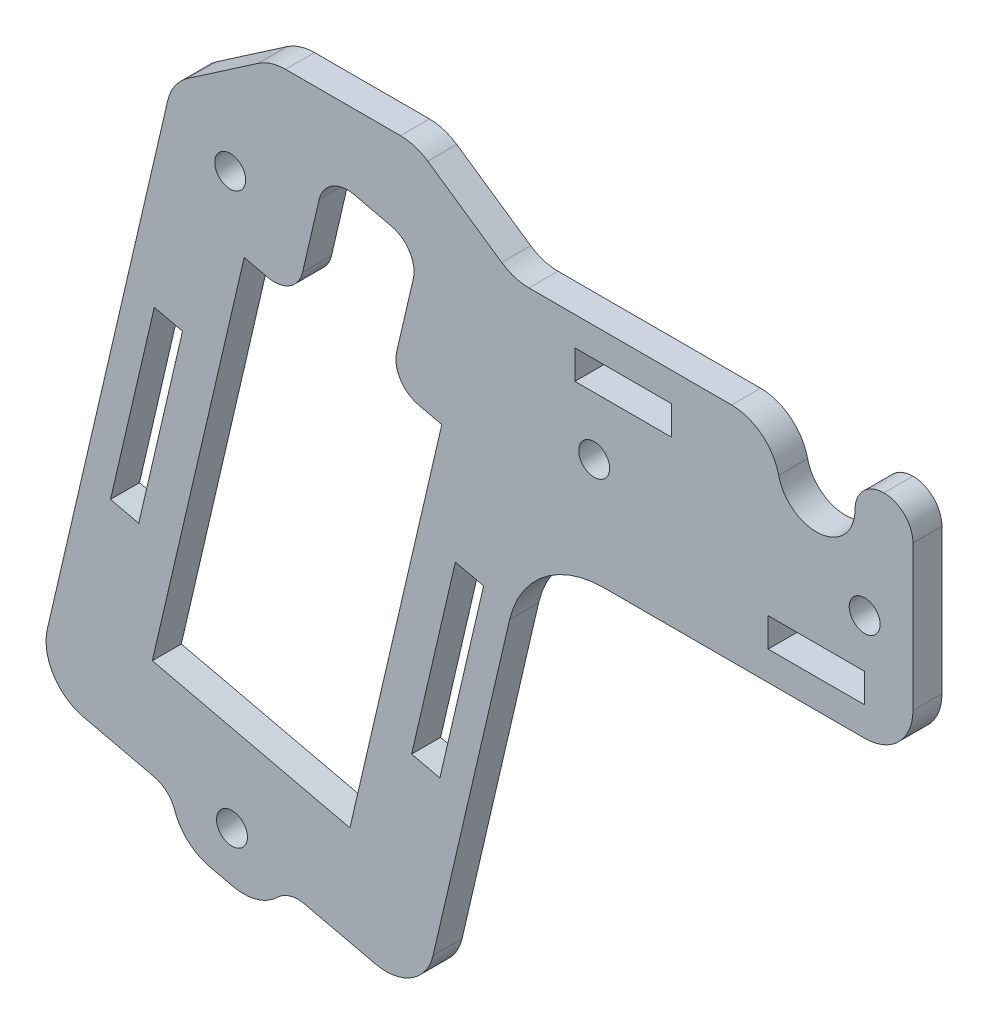
from build123d import *

# Parameters (mm, degrees)
ESBO_O1_R                = 1.6000000000000096
ESBO_O1_R_2              = 1.5999999999999985
ESBO_O1_R_3              = 1.6000000000000019
ESBO_O1_R_4              = 1.6000000000000474
RESSALTO_EXTRUS_O1_DEPTH = 3
FILETE1_R                = 5
FILETE3_R                = 3
FILETE4_R                = 10
FILETE2_R                = 5


with BuildPart() as part:
    # Esboço1 → Ressalto-extrusão1 (new body)
    with BuildSketch(Plane.XY):
        with BuildLine():
            Line((-2.645751311064564, 23.000000000000014), (-31.296028057599443, 23.000000000000004))
            Line((-31.296028057599443, 22.999999999999996), (-41.49853289297047, 29.999999999999996))
            Line((-41.49853289297047, 29.999999999999996), (-56.49853289297047, 29.999999999999996))
            Line((-56.49853289297047, 29.999999999999996), (-66.7010377283415, 23.000000000000014))
            Line((-66.7010377283415, 23.000000000000014), (-80.74287914122172, -37.388961654722316))
            Line((-80.74287914122172, -37.388961654722316), (-65.64563872754113, -40.89942200794237))
            Line((-65.64563872754113, -40.89942200794238), (-66.49494365170727, -44.55198017254248))
            Line((-66.49494365170727, -44.55198017254248), (-56.754788546106894, -46.81679330365219))
            Line((-56.754788546106894, -46.81679330365219), (-55.90548362194077, -43.164235139052074))
            Line((-55.90548362194077, -43.164235139052074), (-40.80824320826024, -46.67469549227213))
            Line((-40.80824320826024, -46.67469549227213), (-29.955288394361567, 0))
            Line((-29.955288394361567, 0), (10, 0))
            Line((10.000000000000002, 0), (10.000000000000002, 23))
            Line((10.000000000000002, 23), (2.6457513110645188, 23.000000000000036))
            ThreePointArc((2.6457513110645325, 23.00000000000005), (2.416e-14, 16), (-2.645751311064569, 23.000000000000018))
        make_face()
        with Locations((-60.49245953335222, -40.81430918529715)):
            Circle(ESBO_O1_R, mode=Mode.SUBTRACT)
        Polygon((-34.44455590239048, -6.060615619977682), (-38.97418216460989, -25.54092583117841), (-41.89622869629002, -24.861481891845507), (-37.36660243407061, -5.381171680644762), align=None, mode=Mode.SUBTRACT)
        Polygon((-70.1426785025311, -18.293523811627356), (-73.06472503421121, -17.61407987229443), (-68.53509877199181, 1.8662303389063053), (-65.61305224031169, 1.1867863995733905), align=None, mode=Mode.SUBTRACT)
        Polygon((-53.86861044577067, 9.749384541179593), (-50.787533444320594, 22.999999999999996), (-41.04737833872022, 20.73518686889029), (-44.12845534017028, 7.484571410069881), (-38.771370032090054, 6.238924187959525), (-48.28358518275084, -34.669727255562044), (-68.73791090451164, -29.91361968023165), (-59.22569575385083, 10.995031763289926), align=None, mode=Mode.SUBTRACT)
        with Locations((-60.676910421506925, 17.999999999999996)):
            Circle(ESBO_O1_R_2, mode=Mode.SUBTRACT)
        Polygon((5.000000000000001, 6), (5, 3.0000000000000018), (-5, 2.9999999999999996), (-5.000000000000001, 5.999999999999999), align=None, mode=Mode.SUBTRACT)
        with Locations((-23.000000000000014, 10.999999999999996)):
            Circle(ESBO_O1_R_3, mode=Mode.SUBTRACT)
        Polygon((-14.999999999999993, 16.999999999999996), (-24.999999999999993, 16.999999999999993), (-24.999999999999993, 19.999999999999996), (-14.999999999999993, 19.999999999999996), align=None, mode=Mode.SUBTRACT)
        with Locations((5.000000000000001, 10.999999999999996)):
            Circle(ESBO_O1_R_4, mode=Mode.SUBTRACT)
    extrude(amount=RESSALTO_EXTRUS_O1_DEPTH)

    # Filete1
    filete1_edges = [part.edges().sort_by_distance(p)[0] for p in [
        (10, 0, 1.5),
        (-40.80824320826024, -46.67469549227213, 1.5),
        (-80.74287914122172, -37.388961654722316, 1.5),
    ]]
    fillet(filete1_edges, radius=FILETE1_R)

    # Filete3
    filete3_edges = [part.edges().sort_by_distance(p)[0] for p in [
        (-65.64563872754113, -40.89942200794238, 1.5),
        (-55.90548362194077, -43.164235139052074, 1.5),
        (2.6457513110645263, 23.000000000000043, 1.5),
        (10.000000000000002, 23, 1.5),
        (-50.787533444320594, 22.999999999999996, 1.5),
        (-41.04737833872022, 20.73518686889029, 1.5),
        (-44.12845534017028, 7.484571410069877, 1.5),
        (-53.86861044577067, 9.749384541179591, 1.5),
    ]]
    fillet(filete3_edges, radius=FILETE3_R - 0.0001)  # a hair under: the kernel refuses the full size

    # Filete4
    filete4_edges = [part.edges().sort_by_distance(p)[0] for p in [
        (-29.955288394361567, 0, 1.5),
    ]]
    fillet(filete4_edges, radius=FILETE4_R)

    # Filete2
    filete2_edges = [part.edges().sort_by_distance(p)[0] for p in [
        (-2.6457513110645667, 23.000000000000014, 1.5),
        (-56.754788546106894, -46.81679330365219, 1.5),
        (-66.49494365170727, -44.55198017254248, 1.5),
        (-31.296028057599443, 23, 1.5),
        (-41.49853289297047, 29.999999999999996, 1.5),
        (-56.49853289297047, 29.999999999999996, 1.5),
        (-66.7010377283415, 23.000000000000014, 1.5),
    ]]
    fillet(filete2_edges, radius=FILETE2_R - 0.0001)  # a hair under: the kernel refuses the full size


solid = part.part
